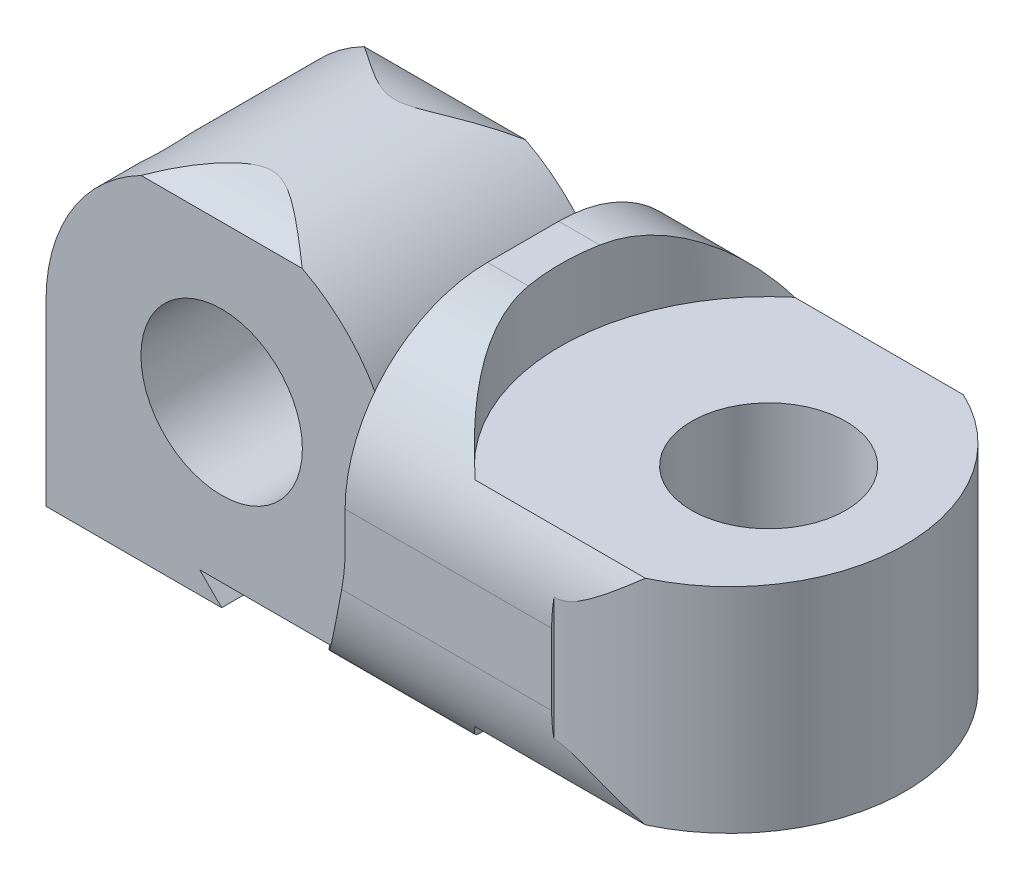
from build123d import *

# Parameters (mm, degrees)
BOSS_EXTRUDE1_DEPTH  = 31.7
CUT_EXTRUDE2_DEPTH   = 15
CUT_EXTRUDE3_START   = -2.8
CUT_EXTRUDE3_DEPTH   = 2.8
SKETCH3_R            = 3.4
CUT_EXTRUDE4_DEPTH   = 10
BOSS_EXTRUDE2_DEPTH  = 9.4
CUT_EXTRUDE7_DEPTH   = 9.4
CUT_EXTRUDE8_DEPTH   = 15
CUT_EXTRUDE9_DEPTH   = 15
SKETCH12_R           = 7.4
CUT_EXTRUDE10_DEPTH  = 3
SKETCH13_R           = 3.25
CUT_EXTRUDE11_DEPTH  = 10.6
SKETCH15_R           = 8.75
CUT_EXTRUDE12_DEPTH  = 4.2
CAVITY2_OUTLINE_R    = 1
CAVITY2_ANGLE        = 31.52604
CAVITY2_2_OUTLINE_R  = 1
CAVITY2_2_ANGLE      = 46.605432
CAVITY2_3_ANGLE      = 48.420137
CAVITY2_4_ANGLE      = 12.449956
CAVITY2_5_OUTLINE_R  = 1
CAVITY2_5_ANGLE      = 46.912628
CAVITY2_6_OUTLINE_R  = 1
CAVITY2_6_ANGLE      = 87.95967
CAVITY2_START        = 2.033929135
CAVITY2_7_OUTLINE_R  = 1
CAVITY2_7_DEPTH      = 1.529989444
CAVITY2_START_2      = 6.038502635
CAVITY2_8_OUTLINE_R  = 1
CAVITY2_8_DEPTH      = 5.769439577
CAVITY2_START_3      = -1.354620357
CAVITY2_9_OUTLINE_R  = 1
CAVITY2_9_DEPTH      = 10.354620357
CAVITY2_START_4      = 1.315988339
CAVITY2_10_OUTLINE_R = 1
CAVITY2_10_DEPTH     = 2.976110694
CAVITY2_START_5      = 4.679948865
CAVITY2_11_OUTLINE_R = 1
CAVITY2_11_DEPTH     = 4.522027877


with BuildPart() as part:
    # Sketch1 → Boss-Extrude1 (new body)
    with BuildSketch(Plane(origin=(0, 0, 0), x_dir=(0, 0, -1), z_dir=(1, 0, 0))):
        with BuildLine():
            Line((-1.5, -7.5), (1.5, -7.5))
            ThreePointArc((1.5, -7.5), (5.742640687, -5.742640687), (7.5, -1.5))
            Line((7.5, -1.5), (7.5, 1.5))
            ThreePointArc((7.5, 1.5), (5.742640687, 5.742640687), (1.5, 7.5))
            Line((1.5, 7.5), (-1.5, 7.5))
            ThreePointArc((-1.5, 7.5), (-5.742640687, 5.742640687), (-7.5, 1.5))
            Line((-7.5, 1.5), (-7.5, -1.5))
            ThreePointArc((-7.5, -1.5), (-5.742640687, -5.742640687), (-1.5, -7.5))
        make_face()
    extrude(amount=BOSS_EXTRUDE1_DEPTH)

    # Sketch2 → Cut-Extrude2 (cut)
    with BuildSketch(Plane(origin=(0, 0, -7.5), x_dir=(-1, 0, 0), z_dir=(0, 0, -1))):
        with BuildLine():
            Line((0, 1.5), (-0.151530772, 1.5))
            ThreePointArc((-0.151530772, 1.5), (-0.037978852, 0.753817215), (0, 0))
            Line((0, 0), (0, 1.5))
        make_face()
        with BuildLine():
            Line((0, 7.5), (-7.5, 7.5))
            ThreePointArc((-7.5, 7.5), (-2.75658351, 5.809475019), (-0.151530772, 1.5))
            Line((-0.151530772, 1.5), (0, 1.5))
            Line((0, 1.5), (0, 7.5))
        make_face()
        with BuildLine():
            Line((0, -1.5), (0, 0))
            ThreePointArc((0, 0), (-0.037978852, -0.753817215), (-0.151530772, -1.5))
            Line((-0.151530772, -1.5), (0, -1.5))
        make_face()
        with BuildLine():
            Line((0, -7.5), (0, -1.5))
            Line((0, -1.5), (-0.151530772, -1.5))
            ThreePointArc((-0.151530772, -1.5), (-2.75658351, -5.809475019), (-7.5, -7.5))
            Line((-7.5, -7.5), (0, -7.5))
        make_face()
    extrude(amount=-CUT_EXTRUDE2_DEPTH, mode=Mode.SUBTRACT)

    # Cut-Extrude3: read off the stored shape, not the designer's step
    # Cut-Extrude3 outline → Cut-Extrude3 (cut)
    with BuildSketch(Plane(origin=(0, 0, -7.5), x_dir=(-1, 0, 0), z_dir=(0, 0, -1)).offset(CUT_EXTRUDE3_START)):
        with BuildLine():
            Line((-7.5, 7.5), (-7.5, 8))
            ThreePointArc((-7.5, 8), (-15.5, 0), (-7.5, -8))
            Line((-7.5, -8), (-7.5, -7.5))
            ThreePointArc((-7.5, -7.5), (0, 0), (-7.5, 7.5))
        make_face()
    cut_extrude3 = extrude(amount=CUT_EXTRUDE3_DEPTH, mode=Mode.SUBTRACT)

    # Mirror1: Cut-Extrude3 across plane
    add(cut_extrude3.mirror(Plane(origin=(0, 0, 0), x_dir=(1, 0, 0), z_dir=(0, 0, -1))), mode=Mode.SUBTRACT)

    # Sketch3 → Cut-Extrude4 (cut)
    with BuildSketch(Plane(origin=(0, 0, -4.7), x_dir=(-1, 0, 0), z_dir=(0, 0, -1))):
        with Locations((-7.5, 0)):
            Circle(SKETCH3_R)
    extrude(amount=-CUT_EXTRUDE4_DEPTH, mode=Mode.SUBTRACT)

    # Sketch5 → Boss-Extrude2 (add)
    with BuildSketch(Plane.XY.offset(4.7)):
        Polygon((0, 0), (0, -7.5), (7.5, -7.5), align=None)
    extrude(amount=-BOSS_EXTRUDE2_DEPTH)

    # Sketch7 → Cut-Extrude7 (cut)
    with BuildSketch(Plane.XY.offset(4.7)):
        with BuildLine():
            Line((0.1, -7.5), (0.1, 0))
            ThreePointArc((0.1, 0), (7.5, 7.4), (14.9, 0))
            Line((14.9, 0), (16.5, 0))
            ThreePointArc((16.5, 0), (7.5, 9), (-1.5, 0))
            Line((-1.5, 0), (0, 0))
            Line((0, 0), (0, -7.5))
            Line((0, -7.5), (0.1, -7.5))
        make_face()
    extrude(amount=-CUT_EXTRUDE7_DEPTH, mode=Mode.SUBTRACT)

    # Sketch8 → Cut-Extrude8 (cut)
    with BuildSketch(Plane(origin=(0, 0, -7.5), x_dir=(-1, 0, 0), z_dir=(0, 0, -1))):
        with BuildLine():
            Line((-15.5, 0), (-15.5, 7.5))
            Line((-15.5, 7.5), (-8, 7.5))
            ThreePointArc((-8, 7.5), (-13.303300859, 5.303300859), (-15.5, 0))
        make_face()
    extrude(amount=-CUT_EXTRUDE8_DEPTH, mode=Mode.SUBTRACT)

    # Sketch10 → Cut-Extrude9 (cut)
    with BuildSketch(Plane(origin=(0, 7.5, 0), x_dir=(1, 0, 0), z_dir=(0, 1, 0))):
        with BuildLine():
            Line((24.2, 7.4), (24.2, 7.5))
            Line((24.2, 7.5), (31.7, 7.5))
            Line((31.7, 7.5), (31.7, 0))
            Line((31.7, 0), (31.7, -7.5))
            Line((31.7, -7.5), (24.2, -7.5))
            Line((24.2, -7.5), (24.2, -7.4))
            ThreePointArc((24.2, -7.4), (31.6, 0), (24.2, 7.4))
        make_face()
    extrude(amount=-CUT_EXTRUDE9_DEPTH, mode=Mode.SUBTRACT)

    # Sketch12 → Cut-Extrude10 (cut)
    with BuildSketch(Plane(origin=(0, 7.5, 0), x_dir=(1, 0, 0), z_dir=(0, 1, 0))):
        with Locations((25.3, 0)):
            Circle(SKETCH12_R)
    cut_extrude10 = extrude(amount=-CUT_EXTRUDE10_DEPTH, mode=Mode.SUBTRACT)

    # Mirror2: Cut-Extrude10 across plane
    add(cut_extrude10.mirror(Plane.ZX), mode=Mode.SUBTRACT)

    # Sketch13 → Cut-Extrude11 (cut)
    with BuildSketch(Plane(origin=(0, 4.5, 0), x_dir=(1, 0, 0), z_dir=(0, 1, 0))):
        with Locations(Location((25.843892142, 0, 0), (0, 0, 270))):
            Circle(SKETCH13_R)
    extrude(amount=-CUT_EXTRUDE11_DEPTH, mode=Mode.SUBTRACT)

    # Sketch15 → Cut-Extrude12 (cut)
    with BuildSketch(Plane.XZ.offset(4.5)):
        with Locations((25.843892142, 0.027482577)):
            Circle(SKETCH15_R)
    cut_extrude12 = extrude(amount=CUT_EXTRUDE12_DEPTH, mode=Mode.SUBTRACT)

    # Mirror3: Cut-Extrude12 across plane
    add(cut_extrude12.mirror(Plane.ZX), mode=Mode.SUBTRACT)

    # Cavity2: read off the stored shape, not the designer's step
    # Cavity2 outline → Cavity2 (revolve, cut)
    with BuildSketch(Plane(origin=(-1.065045733, 0, -3.941456042), x_dir=(0.23300341047675205, 0, 0.9724759178026993), z_dir=(-0.9724759178026993, 0, 0.23300341047675205))):
        with Locations((4, -4.623251355)):
            Circle(CAVITY2_OUTLINE_R)
    revolve(axis=Axis((-1.065045733, 0, -3.941456042), (0, 1, 0)), revolution_arc=CAVITY2_ANGLE, mode=Mode.SUBTRACT)

    # Cavity2 2 outline → Cavity2 2 (revolve, cut)
    with BuildSketch(Plane(origin=(5.823101072, -1.609144255, 0.782959223), x_dir=(0.05450517343655316, 0.22376145640796816, -0.9731186960976738), z_dir=(0.9715910573711101, -0.2366660458039747, 4.260480856999038e-15))):
        with Locations((3, -4.221382407)):
            Circle(CAVITY2_2_OUTLINE_R)
    revolve(axis=Axis((5.823101072, -1.609144255, 0.782959223), (0.23030415390335526, 0.9454734228891349, 0.23030415390340622)), revolution_arc=CAVITY2_2_ANGLE, mode=Mode.SUBTRACT)

    # Cavity2 3 outline → Cavity2 3 (revolve, cut)
    with BuildSketch(Plane(origin=(9.909952256, -9.209268335, 0), x_dir=(0.883847188724354, 0.46777574433061003, 0), z_dir=(0.46777574433061003, -0.883847188724354, 0))):
        with BuildLine():
            Line((2.001547376, -3.164207738), (2.001547376, -3.686498117))
            Line((2.001547376, -3.686498117), (2.183891953, -3.686498117))
            ThreePointArc((2.183891953, -3.686498117), (3.94411568, -2.778984476), (2.001547376, -3.164207738))
        make_face()
    revolve(axis=Axis((9.909952256, -9.209268335, 0), (0, 0, 1)), revolution_arc=CAVITY2_3_ANGLE, mode=Mode.SUBTRACT)

    # Cavity2 4 outline → Cavity2 4 (revolve, cut)
    with BuildSketch(Plane(origin=(-0.274321706, 0, 2.058543958), x_dir=(0.7303134087166578, 0, -0.6831122345915464), z_dir=(0.6831122345915464, 0, 0.7303134087166578))):
        with BuildLine():
            Line((2.986775363, 4.845398789), (1.864195821, 4.845398789))
            Line((1.864195821, 4.845398789), (1.864195821, 3.692569339))
            ThreePointArc((1.864195821, 3.692569339), (2.716443943, 3.985660375), (2.986775363, 4.845398789))
        make_face()
    revolve(axis=Axis((-0.274321706, 0, 2.058543958), (0, 1, 0)), revolution_arc=CAVITY2_4_ANGLE, mode=Mode.SUBTRACT)

    # Cavity2 5 outline → Cavity2 5 (revolve, cut)
    with BuildSketch(Plane(origin=(4.679948965, 0, 1.499584404), x_dir=(-0.7303128550096672, 0, 0.6831128265576842), z_dir=(-0.6831128265576842, 0, -0.7303128550096672))):
        with Locations((2, 4.683305038)):
            Circle(CAVITY2_5_OUTLINE_R)
    revolve(axis=Axis((4.679948965, 0, 1.499584404), (0, 1, 0)), revolution_arc=CAVITY2_5_ANGLE, mode=Mode.SUBTRACT)

    # Cavity2 6 outline → Cavity2 6 (revolve, cut)
    with BuildSketch(Plane(origin=(9.201976642, 1.683305038, 0), x_dir=(0.9993660137169944, 0.035602958127158836, 0), z_dir=(0.035602958127158836, -0.9993660137169944, 0))):
        with Locations((3, 3.499584404)):
            Circle(CAVITY2_6_OUTLINE_R)
    revolve(axis=Axis((9.201976642, 1.683305038, 0), (0, 0, 1)), revolution_arc=CAVITY2_6_ANGLE, mode=Mode.SUBTRACT)

    # Cavity2 7 outline → Cavity2 7 (cut)
    with BuildSketch(Plane(origin=(0, 0, 0), x_dir=(0.7071067811865541, 0, 0.707106781186541), z_dir=(0.707106781186541, 0, -0.707106781186554)).offset(CAVITY2_START)):
        with Locations((0.459868645, 4.623251355)):
            Circle(CAVITY2_7_OUTLINE_R)
    extrude(amount=CAVITY2_7_DEPTH, mode=Mode.SUBTRACT)

    # Cavity2 8 outline → Cavity2 8 (cut)
    with BuildSketch(Plane(origin=(0, 0, 0), x_dir=(0.23666604580397302, 0.9715910573711101, 0), z_dir=(0.9715910573711101, -0.23666604580397302, 0)).offset(CAVITY2_START_2)):
        with Locations((-3.602293545, -3.108598769)):
            Circle(CAVITY2_8_OUTLINE_R)
    extrude(amount=CAVITY2_8_DEPTH, mode=Mode.SUBTRACT)

    # Cavity2 9 outline → Cavity2 9 (cut)
    with BuildSketch(Plane(origin=(0, 0, 0), x_dir=(0.9993660137169944, 0.03560295812715721, 0), z_dir=(0.03560295812715721, -0.9993660137169944, 0)).offset(CAVITY2_START_3)):
        with Locations((12.256073353, 3.499584404)):
            Circle(CAVITY2_9_OUTLINE_R)
    extrude(amount=CAVITY2_9_DEPTH, mode=Mode.SUBTRACT)

    # Cavity2 10 outline → Cavity2 10 (cut)
    with BuildSketch(Plane(origin=(0, 0, 0), x_dir=(0.7303128550096671, 0, -0.6831128265576842), z_dir=(0.6831128265576842, 0, 0.7303128550096672)).offset(CAVITY2_START_4)):
        with Locations((0.393441549, 4.683305038)):
            Circle(CAVITY2_10_OUTLINE_R)
    extrude(amount=CAVITY2_10_DEPTH, mode=Mode.SUBTRACT)

    # Cavity2 11 outline → Cavity2 11 (cut)
    with BuildSketch(Plane.YZ.offset(CAVITY2_START_5)):
        with Locations((4.683305038, 3.499584404)):
            Circle(CAVITY2_11_OUTLINE_R)
    extrude(amount=CAVITY2_11_DEPTH, mode=Mode.SUBTRACT)


solid = part.part
